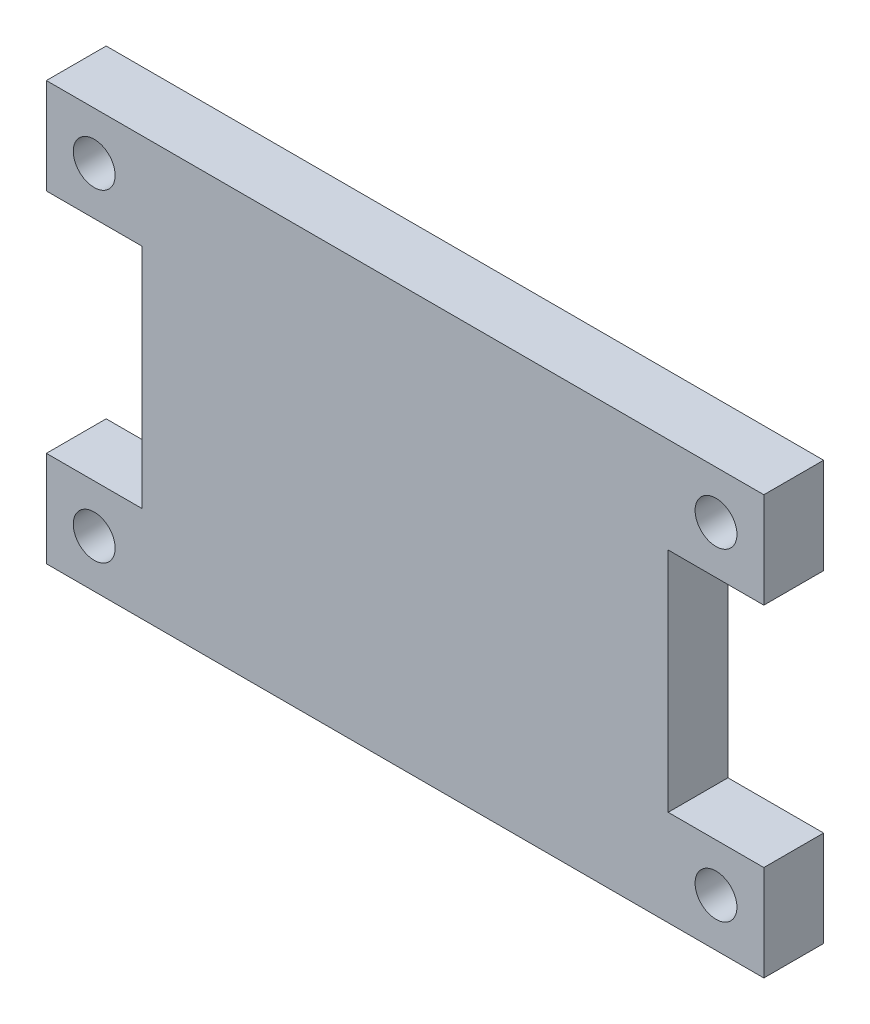
from build123d import *

# Parameters (mm, degrees)
SKETCH_1_R      = 1.75
EXTRUDE_1_DEPTH = 5


with BuildPart() as part:
    # 草圖1 → 填料-伸長1 (new body)
    with BuildSketch(Plane.XY):
        Polygon((-30, 17.5), (-30, 9.5), (-22, 9.5), (-22, -9.5), (-30, -9.5), (-30, -17.5), (30, -17.5), (30, -9.5), (22, -9.5), (22, 9.5), (30, 9.5), (30, 17.5), align=None)
        with Locations((26, 13.5)):
            Circle(SKETCH_1_R, mode=Mode.SUBTRACT)
        with Locations((26, -13.5)):
            Circle(SKETCH_1_R, mode=Mode.SUBTRACT)
        with Locations((-26, -13.5)):
            Circle(SKETCH_1_R, mode=Mode.SUBTRACT)
        with Locations((-26, 13.5)):
            Circle(SKETCH_1_R, mode=Mode.SUBTRACT)
    extrude(amount=EXTRUDE_1_DEPTH)


solid = part.part
